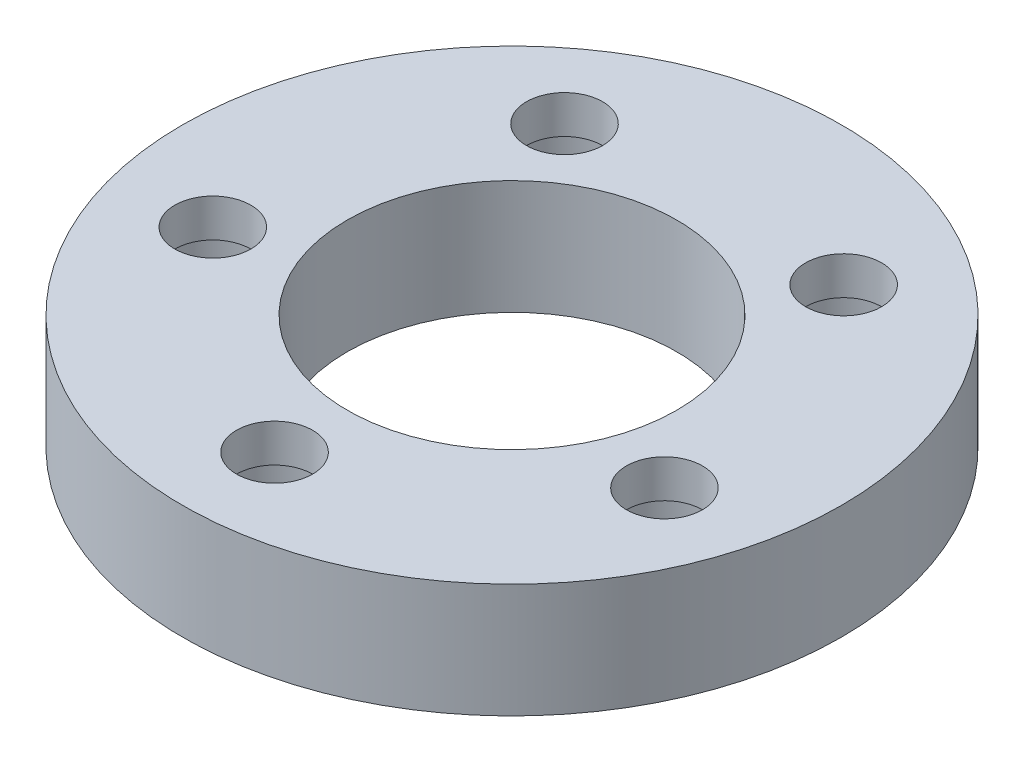
from build123d import *

# Parameters (mm, degrees)
SKETCH1_W          = 11
SKETCH1_H          = 7.62
SKETCH2_R          = 2.54
CUT_EXTRUDE1_DEPTH = 33.032240009
SKETCH3_R          = 3.96875
CUT_EXTRUDE2_DEPTH = 5.08


with BuildPart() as part:
    # Sketch1 → Revolve1 (revolve)
    with BuildSketch(Plane.XY):
        with Locations((16.5, -29.147212191)):
            Rectangle(SKETCH1_W, SKETCH1_H)
    revolve(axis=Axis((0, 18.662787809, 0), (0, -1, 0)))

    # Sketch2 → Cut-Extrude1 (cut, through all)
    with BuildSketch(Plane.XZ.offset(32.957212191)):
        with Locations((15.074245783, 4.897919361)):
            Circle(SKETCH2_R)
        with Locations((0, 15.85)):
            Circle(SKETCH2_R)
        with Locations((9.316396249, -12.822919361)):
            Circle(SKETCH2_R)
        with Locations((-9.316396249, -12.822919361)):
            Circle(SKETCH2_R)
        with Locations((-15.074245783, 4.897919361)):
            Circle(SKETCH2_R)
    extrude(amount=-CUT_EXTRUDE1_DEPTH, mode=Mode.SUBTRACT)

    # Sketch3 → Cut-Extrude2 (cut)
    with BuildSketch(Plane(origin=(0, -32.957212191, 0), x_dir=(-1, 0, 0), z_dir=(0, -1, 0))):
        with Locations((0, -15.85)):
            Circle(SKETCH3_R)
        with Locations((-15.074245783, -4.897919361)):
            Circle(SKETCH3_R)
        with Locations((-9.316396249, 12.822919361)):
            Circle(SKETCH3_R)
        with Locations((9.316396249, 12.822919361)):
            Circle(SKETCH3_R)
        with Locations((15.074245783, -4.897919361)):
            Circle(SKETCH3_R)
    extrude(amount=-CUT_EXTRUDE2_DEPTH, mode=Mode.SUBTRACT)


solid = part.part
